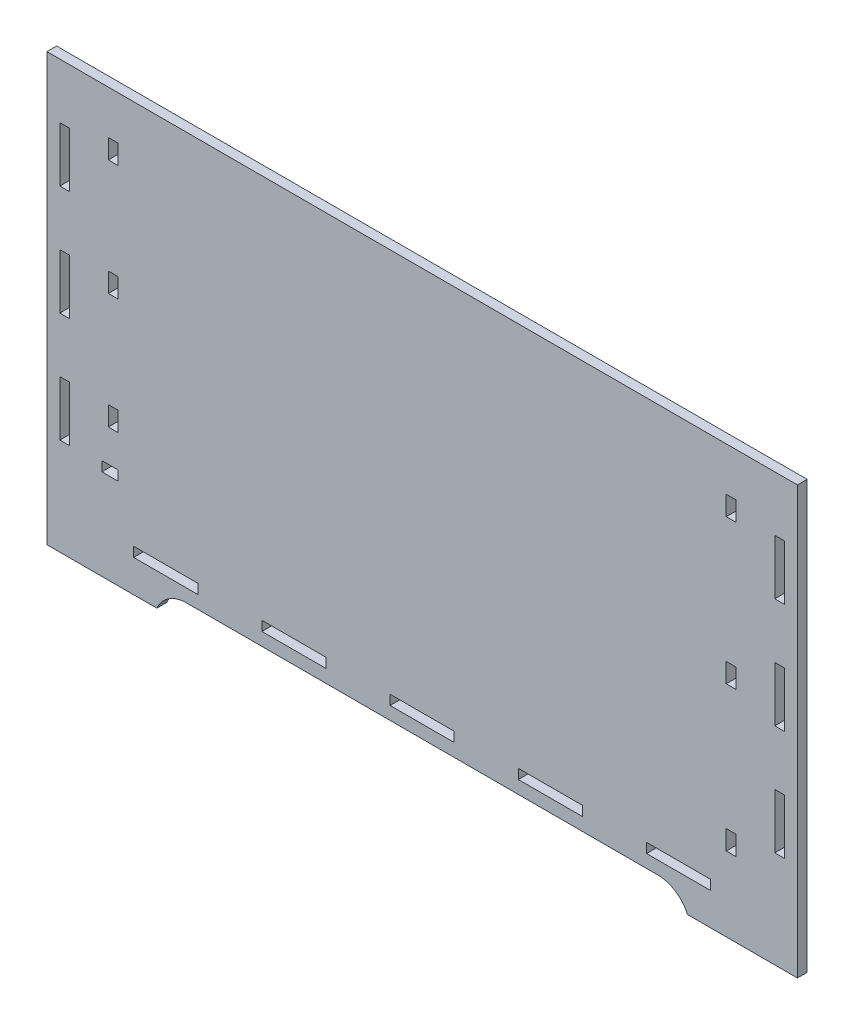
from build123d import *

# Parameters (mm, degrees)
SKETCH1_W           = 436
SKETCH1_H           = 238
BOSS_EXTRUDE1_DEPTH = 6
SKETCH2_W           = 6
SKETCH2_H           = 12
SKETCH2_W_2         = 10
SKETCH2_H_2         = 6
CUT_EXTRUDE1_DEPTH  = 6
SKETCH3_W           = 6
SKETCH3_H           = 34
BOSS_EXTRUDE2_DEPTH = 6
SKETCH4_W           = 39.636363636
SKETCH4_H           = 6
SKETCH4_W_2         = 6
SKETCH4_W_3         = 39.636363637
BOSS_EXTRUDE3_DEPTH = 6
SKETCH5_W           = 60
SKETCH5_H           = 12
SKETCH5_W_2         = 448
SKETCH5_H_2         = 8
BOSS_EXTRUDE4_DEPTH = 6
FILLET1_R           = 20
SKETCH6_W           = 6
SKETCH6_H           = 264
BOSS_EXTRUDE5_DEPTH = 8
SKETCH7_W           = 6
SKETCH7_H           = 12
CUT_EXTRUDE2_DEPTH  = 274.651237892


with BuildPart() as part:
    # Sketch1 → Boss-Extrude1 (new body)
    with BuildSketch(Plane.XY):
        Rectangle(SKETCH1_W, SKETCH1_H)
    extrude(amount=BOSS_EXTRUDE1_DEPTH)

    # Sketch2 → Cut-Extrude1 (cut)
    with BuildSketch(Plane(origin=(0, 0, 0), x_dir=(-1, 0, 0), z_dir=(0, 0, -1))):
        with Locations((191, 86)):
            Rectangle(SKETCH2_W, SKETCH2_H)
        with Locations((191, 14.5)):
            Rectangle(SKETCH2_W, SKETCH2_H)
        with Locations((191, -57)):
            Rectangle(SKETCH2_W, SKETCH2_H)
        with Locations((193, -86)):
            Rectangle(SKETCH2_W_2, SKETCH2_H_2)
    extrude(amount=-CUT_EXTRUDE1_DEPTH, mode=Mode.SUBTRACT)

    # Sketch3 → Boss-Extrude2 (add)
    with BuildSketch(Plane.ZY.offset(218)):
        with Locations((3, 102)):
            Rectangle(SKETCH3_W, SKETCH3_H)
        with Locations((3, 34)):
            Rectangle(SKETCH3_W, SKETCH3_H)
        with Locations((3, -34)):
            Rectangle(SKETCH3_W, SKETCH3_H)
        with Locations((3, -102)):
            Rectangle(SKETCH3_W, SKETCH3_H)
    boss_extrude2 = extrude(amount=BOSS_EXTRUDE2_DEPTH)

    # Mirror1: Boss-Extrude2 across plane
    add(boss_extrude2.mirror(Plane(origin=(0, 0, 0), x_dir=(0, 0, 1), z_dir=(1, 0, 0))))

    # Sketch4 → Boss-Extrude3 (add)
    with BuildSketch(Plane.XZ.offset(119)):
        with Locations((-198.181818182, 3)):
            Rectangle(SKETCH4_W, SKETCH4_H)
        with Locations((-221, 3)):
            Rectangle(SKETCH4_W_2, SKETCH4_H)
        with Locations((-118.909090909, 3)):
            Rectangle(SKETCH4_W, SKETCH4_H)
        with Locations((-39.636363637, 3)):
            Rectangle(SKETCH4_W_3, SKETCH4_H)
        with Locations((39.636363637, 3)):
            Rectangle(SKETCH4_W_3, SKETCH4_H)
        with Locations((118.909090909, 3)):
            Rectangle(SKETCH4_W, SKETCH4_H)
        with Locations((198.181818182, 3)):
            Rectangle(SKETCH4_W, SKETCH4_H)
        with Locations((221, 3)):
            Rectangle(SKETCH4_W_2, SKETCH4_H)
    extrude(amount=BOSS_EXTRUDE3_DEPTH)

    # Sketch5 → Boss-Extrude4 (add)
    with BuildSketch(Plane(origin=(0, 0, 0), x_dir=(-1, 0, 0), z_dir=(0, 0, -1))):
        with Locations((194, -139)):
            Rectangle(SKETCH5_W, SKETCH5_H)
        with Locations((-194, -139)):
            Rectangle(SKETCH5_W, SKETCH5_H)
        with Locations((0, -129)):
            Rectangle(SKETCH5_W_2, SKETCH5_H_2)
    extrude(amount=-BOSS_EXTRUDE4_DEPTH)

    # Fillet1
    # the kernel refuses this fillet: 20 mm, written as the material it adds along each edge
    with BuildSketch(Plane(origin=(164, -133, 0), x_dir=(0, -1, 0), z_dir=(0, 0, 1))) as fillet1_piece_1:
        with BuildLine():
            CenterArc((20, -18.33030278), FILLET1_R, 113.578178478, 66.421821522)
            Line((0, -18.33030278), (-0.4, -18.33030278))
            Line((-0.4, -18.33030278), (-0.4, 0))
            Line((-0.4, 0), (0, 0.4))
            ThreePointArc((0, 0.4), (6, 0.4), (11.84, 0.366606056))
            Line((11.84, 0.366606056), (12, 0))
        make_face()
    extrude(amount=6)
    with BuildSketch(Plane(origin=(-164, -133, 0), x_dir=(1, 0, 0), z_dir=(0, 0, 1))) as fillet1_piece_2:
        with BuildLine():
            CenterArc((18.33030278, -20), FILLET1_R, 90, 66.421821522)
            Line((0, -12), (-0.366606056, -11.84))
            ThreePointArc((-0.366606056, -11.84), (-0.4, -6), (-0.4, 0))
            Line((-0.4, 0), (0, 0.4))
            Line((0, 0.4), (18.33030278, 0.4))
            Line((18.33030278, 0.4), (18.33030278, 0))
        make_face()
    extrude(amount=6)

    # Sketch6 → Boss-Extrude5 (add)
    with BuildSketch(Plane.ZY.offset(224)):
        with Locations((3, -13)):
            Rectangle(SKETCH6_W, SKETCH6_H)
    boss_extrude5 = extrude(amount=BOSS_EXTRUDE5_DEPTH)

    # Mirror2: Boss-Extrude5 across plane
    add(boss_extrude5.mirror(Plane(origin=(0, 0, 0), x_dir=(0, 0, 1), z_dir=(1, 0, 0))))

    # Sketch7 → Cut-Extrude2 (cut, through all)
    with BuildSketch(Plane(origin=(0, 0, 0), x_dir=(-1, 0, 0), z_dir=(0, 0, -1))):
        with Locations((-191, 86)):
            Rectangle(SKETCH7_W, SKETCH7_H)
        with Locations((-191, -3.5)):
            Rectangle(SKETCH7_W, SKETCH7_H)
        with Locations((-191, -93)):
            Rectangle(SKETCH7_W, SKETCH7_H)
    extrude(amount=-CUT_EXTRUDE2_DEPTH, mode=Mode.SUBTRACT)


solid = part.part
